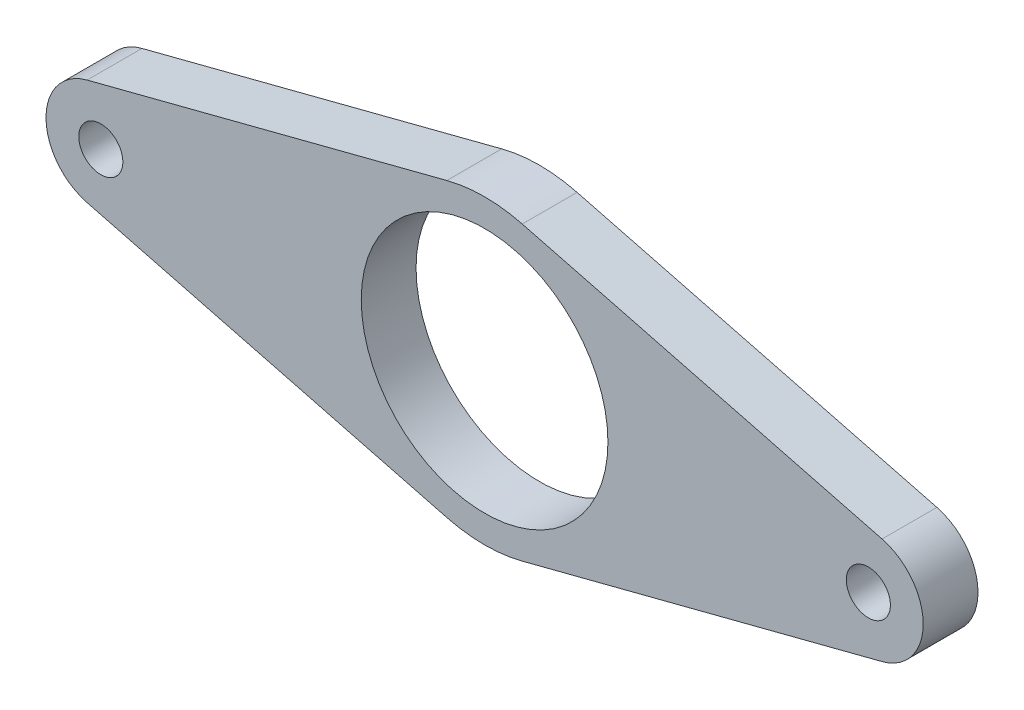
from build123d import *

# Parameters (mm, degrees)
SKETCH1_R           = 2.5527
SKETCH1_R_2         = 14.2875
BOSS_EXTRUDE1_DEPTH = 6.35


with BuildPart() as part:
    # Sketch1 → Boss-Extrude1 (new body)
    with BuildSketch(Plane.XY):
        with BuildLine():
            Line((-4.365625, 16.907992921), (-46.0375, 6.148361062))
            ThreePointArc((-46.0375, 6.148361062), (-50.8, 0), (-46.0375, -6.148361062))
            Line((-46.0375, -6.148361062), (-4.365625, -16.907992921))
            ThreePointArc((-4.365625, -16.907992921), (0, -17.4625), (4.365625, -16.907992921))
            Line((4.365625, -16.907992921), (46.0375, -6.148361062))
            ThreePointArc((46.0375, -6.148361062), (50.8, 0), (46.0375, 6.148361062))
            Line((46.0375, 6.148361062), (4.365625, 16.907992921))
            ThreePointArc((4.365625, 16.907992921), (0, 17.4625), (-4.365625, 16.907992921))
        make_face()
        with Locations((-44.45, 0)):
            Circle(SKETCH1_R, mode=Mode.SUBTRACT)
        Circle(SKETCH1_R_2, mode=Mode.SUBTRACT)
        with Locations((44.45, 0)):
            Circle(SKETCH1_R, mode=Mode.SUBTRACT)
    extrude(amount=BOSS_EXTRUDE1_DEPTH)


solid = part.part
